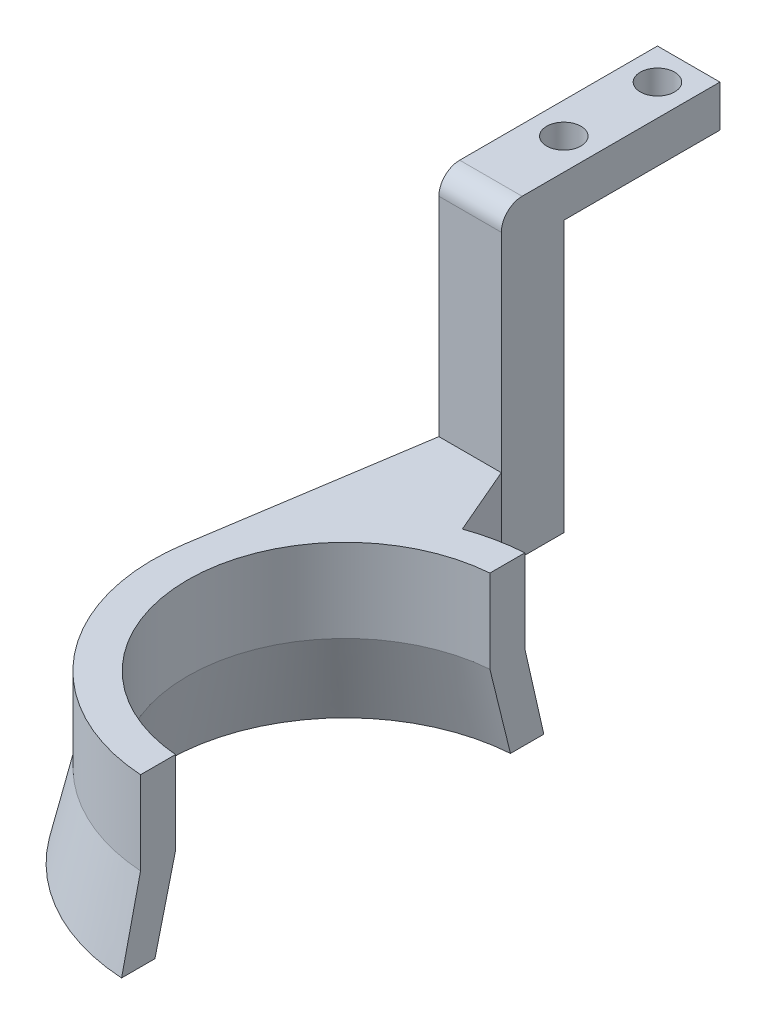
from build123d import *

# Parameters (mm, degrees)
SKETCH_1_W          = 6
SKETCH_1_H          = 15
SKETCH_1_R          = 1.65
EXTRUDE_1_DEPTH     = 2
EXTRUDE_2_DEPTH     = 6
SKETCH_3_W          = 6
SKETCH_3_H          = 30
EXTRUDE_3_DEPTH     = 8
EXTRUDE_4_DEPTH     = 8
CUT_EXTRUDE_1_REACH = 70.569
EXTRUDE_5_DEPTH     = 8
EXTRUDE_START       = 2
SKETCH_11_W         = 6
SKETCH_11_H         = 15
SKETCH_11_R         = 1.65
EXTRUDE_6_DEPTH     = 2


with BuildPart() as part:
    # 草图1 → 凸台-拉伸1 (new body)
    with BuildSketch(Plane(origin=(0, 0, 0), x_dir=(1, 0, 0), z_dir=(0, 1, 0))):
        with Locations((3, -7.5)):
            Rectangle(SKETCH_1_W, SKETCH_1_H)
        with Locations((3, -3)):
            Circle(SKETCH_1_R, mode=Mode.SUBTRACT)
        with Locations((3, -12)):
            Circle(SKETCH_1_R, mode=Mode.SUBTRACT)
    extrude(amount=EXTRUDE_1_DEPTH)

    # 草图2 → 凸台-拉伸2 (add)
    with BuildSketch(Plane(origin=(6, 0, 0), x_dir=(0, 0, -1), z_dir=(1, 0, 0))):
        with BuildLine():
            Line((-15, 2), (-19, 2))
            ThreePointArc((-19, 2), (-20.414213562, 1.414213562), (-21, 0))
            Line((-21, 0), (-21, -20))
            Line((-21, -20), (-15, -20))
            Line((-15, -20), (-15, 2))
        make_face()
    extrude(amount=-EXTRUDE_2_DEPTH)

    # 草图3 → 凸台-拉伸3 (add)
    with BuildSketch(Plane.XZ.offset(20)):
        with Locations((3, 30)):
            Rectangle(SKETCH_3_W, SKETCH_3_H)
    extrude(amount=EXTRUDE_3_DEPTH)

    # 草图5 → 凸台-拉伸4 (add)
    with BuildSketch(Plane(origin=(0, -20, 0), x_dir=(1, 0, 0), z_dir=(0, 1, 0))):
        with BuildLine():
            Line((13.8, -63.461040057), (13.8, -26.538959943))
            ThreePointArc((13.8, -26.538959943), (11.272674372, -26.879375186), (8.816173457, -27.564109163))
            Line((8.816173457, -27.564109163), (6, -21))
            Line((6, -21), (6, -28.836770125))
            ThreePointArc((6, -28.836770125), (-3.04771501, -49.065708168), (13.8, -63.461040057))
        make_face()
    extrude(amount=-EXTRUDE_4_DEPTH)

    # 草图7 → 切除-拉伸1 (cut, up to next)
    with BuildSketch(Plane(origin=(0, -20, 0), x_dir=(1, 0, 0), z_dir=(0, 1, 0)), mode=Mode.PRIVATE) as cut_extrude_1_sk1:
        with BuildLine():
            Line((13.8, -29.897599529), (13.8, -60.102400471))
            ThreePointArc((13.8, -60.102400471), (-0.15, -45), (13.8, -29.897599529))
        make_face()
    cut_extrude_1_tool1 = extrude(cut_extrude_1_sk1.sketch, amount=-CUT_EXTRUDE_1_REACH, mode=Mode.PRIVATE) & part.part
    add(cut_extrude_1_tool1.solids().sort_by_distance((7.916976, -20, 45))[0], mode=Mode.SUBTRACT)

    # 草图8 → 凸台-拉伸5 (add)
    with BuildSketch(Plane(origin=(0, -20, 0), x_dir=(1, 0, 0), z_dir=(0, 1, 0))):
        Polygon((0, -21), (-3.295697184, -42.258200487), (2.143402069, -32.702141854), align=None)
    extrude(amount=-EXTRUDE_5_DEPTH)

    # 草图10 for 放样1 → 放样1 section 0
    with BuildSketch(Plane.XZ.offset(28)):
        with BuildLine():
            Line((13.8, 63.461040057), (13.8, 60.102400471))
            # circular arc as an exact rational Bezier (weights 1, cos(half-angle), 1)
            Bezier((13.8, 60.102400471), (-176.26875, 45), (13.8, 29.897599529), weights=[1, 0.079207921, 1])
            Line((13.8, 29.897599529), (13.8, 26.538959943))
            Bezier((13.8, 26.538959943), (-270.208333333, 45), (13.8, 63.461040057), weights=[1, 0.064864865, 1])
        make_face()
    # 草图9 for 放样1 → 放样1 section 1
    with BuildSketch(Plane(origin=(0, -36, 0), x_dir=(-1, 0, 0), z_dir=(0, -1, 0))):
        with BuildLine():
            Line((-13.8, -24.715464018), (-13.8, -27.922107858))
            Bezier((-13.8, -27.922107858), (229.245333333, -45), (-13.8, -62.077892142), weights=[1, 0.070093458, 1])
            Line((-13.8, -62.077892142), (-13.8, -65.284535982))
            Bezier((-13.8, -65.284535982), (329.085333333, -45), (-13.8, -24.715464018), weights=[1, 0.059055118, 1])
        make_face()
    loft()

    # 草图11 → 凸台-拉伸6 (add)
    with BuildSketch(Plane.XZ.offset(EXTRUDE_START)):
        with Locations((3, 7.5)):
            Rectangle(SKETCH_11_W, SKETCH_11_H)
        with Locations((3, 12)):
            Circle(SKETCH_11_R, mode=Mode.SUBTRACT)
        with Locations((3, 3)):
            Circle(SKETCH_11_R, mode=Mode.SUBTRACT)
    extrude(amount=-EXTRUDE_6_DEPTH)


solid = part.part
